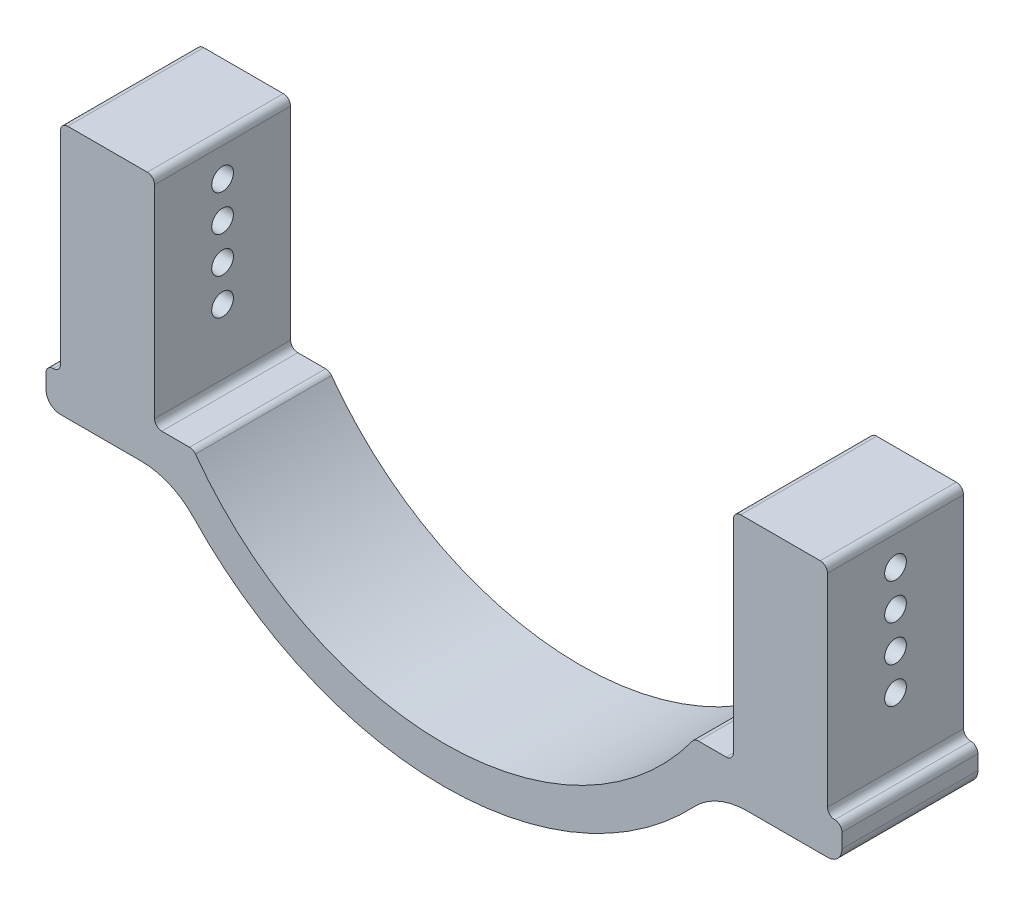
from build123d import *

# Parameters (mm, degrees)
BOSS_EXTRUDE1_DEPTH = 18.8
SKETCH2_R           = 1.5
CUT_EXTRUDE1_DEPTH  = 168.8
FILLET1_R           = 1
FILLET2_R           = 1


with BuildPart() as part:
    # Sketch1 → Boss-Extrude1 (new body)
    with BuildSketch(Plane.XY):
        with BuildLine():
            Line((53, 10), (40, 10))
            Line((40, 10), (40, -20))
            Line((40, -20), (34.641016151, -20))
            ThreePointArc((34.641016151, -20), (0, -37.877855496), (-34.641016151, -20))
            Line((-34.641016151, -20), (-40, -20))
            Line((-40, -20), (-40, 10))
            Line((-40, 10), (-53, 10))
            Line((-53, 10), (-53, -20))
            Line((-53, -20), (-55, -20))
            Line((-55, -20), (-55, -23))
            ThreePointArc((-55, -23), (-54.414213562, -24.414213562), (-53, -25))
            Line((-53, -25), (-41.872771696, -25))
            ThreePointArc((-41.872771696, -25), (-37.918765594, -25.814912317), (-34.609193147, -28.12683285))
            ThreePointArc((-34.609193147, -28.12683285), (0, -43.025434322), (34.609193147, -28.12683285))
            ThreePointArc((34.609193147, -28.12683285), (37.918765594, -25.814912317), (41.872771696, -25))
            Line((41.872771696, -25), (53, -25))
            ThreePointArc((53, -25), (54.414213562, -24.414213562), (55, -23))
            Line((55, -23), (55, -20))
            Line((55, -20), (53, -20))
            Line((53, -20), (53, 10))
        make_face()
    extrude(amount=BOSS_EXTRUDE1_DEPTH)

    # Sketch2 → Cut-Extrude1 (cut)
    with BuildSketch(Plane.ZY.offset(53)):
        with Locations((9.4, -5)):
            Circle(SKETCH2_R)
        with Locations((9.4, 5)):
            Circle(SKETCH2_R)
        with Locations((9.4, 0)):
            Circle(SKETCH2_R)
        with Locations((9.4, -10)):
            Circle(SKETCH2_R)
    extrude(amount=-CUT_EXTRUDE1_DEPTH, mode=Mode.SUBTRACT)

    # Fillet1
    fillet1_edges = [part.edges().sort_by_distance(p)[0] for p in [
        (-40, -20, 9.4),
        (-34.641016151, -20, 9.4),
        (34.641016151, -20, 9.4),
        (40, -20, 9.4),
    ]]
    fillet(fillet1_edges, radius=FILLET1_R)

    # Fillet2
    fillet2_edges = [part.edges().sort_by_distance(p)[0] for p in [
        (-55, -20, 9.4),
        (-53, -20, 9.4),
        (-40, 10, 9.4),
        (-53, 10, 9.4),
        (55, -20, 9.4),
        (53, -20, 9.4),
        (53, 10, 9.4),
        (40, 10, 9.4),
    ]]
    fillet(fillet2_edges, radius=FILLET2_R - 0.0001)  # a hair under: the kernel refuses the full size


solid = part.part
